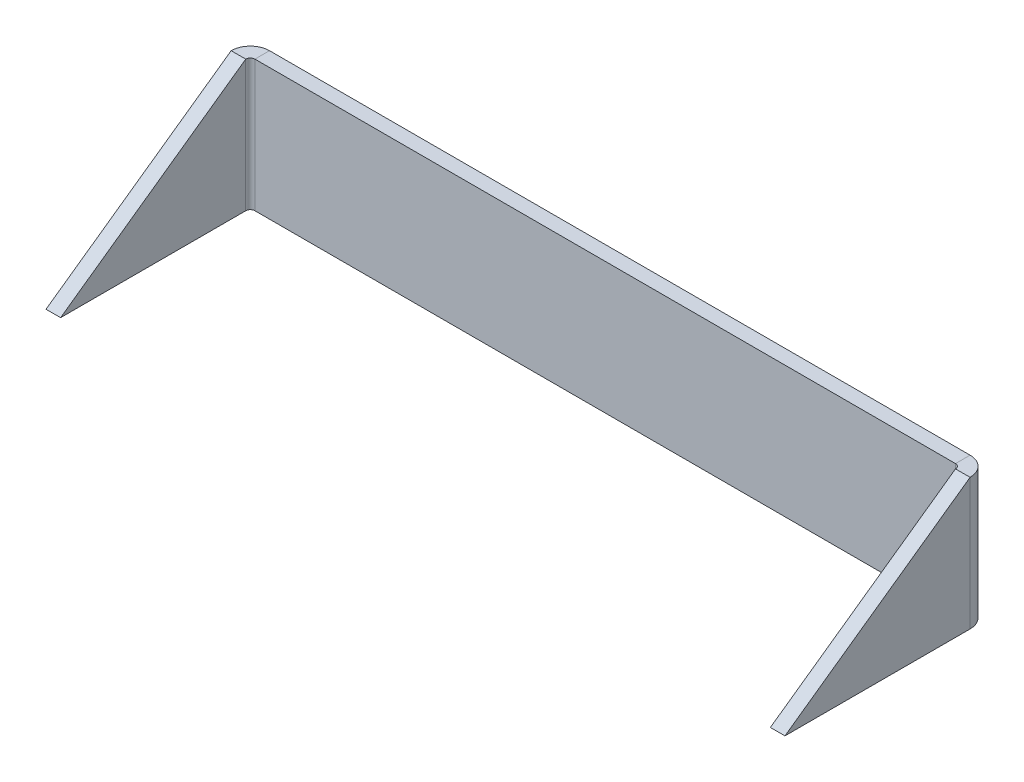
from build123d import *

# Parameters (mm, degrees)
SKETCH2_W          = 152.4
SKETCH2_H          = 28.575
BASE_FLANGE1_DEPTH = 3.175
EDGE_FLANGE1_DEPTH = 28.575
CUT_EXTRUDE1_START = -3.175
CUT_EXTRUDE1_DEPTH = 167.563083351


# Sheet-metal steps are written as plain solids
with BuildPart() as part:
    # Sketch2 → Base-Flange1 (new body)
    with BuildSketch(Plane.XY):
        Rectangle(SKETCH2_W, SKETCH2_H)
    extrude(amount=BASE_FLANGE1_DEPTH)

    # Edge-Flange1 section (across the edge) → Edge-Flange1 (add)
    with BuildSketch(Plane(origin=(77.2, -14.2875, 3.175), x_dir=(-1, 0, 0), z_dir=(0, 1, 0))):
        with BuildLine():
            Line((-3.175, 1), (-3.175, 41.275))
            Line((-3.175, 41.275), (0, 41.275))
            Line((0, 41.275), (0, 1))
            ThreePointArc((0, 1), (0.292893219, 0.292893219), (1, 0))
            Line((1, 0), (1, -3.175))
            ThreePointArc((1, -3.175), (-1.952170811, -1.952170811), (-3.175, 1))
        make_face()
    edge_flange1 = extrude(amount=EDGE_FLANGE1_DEPTH)

    # Sketch10 → Cut-Extrude1 (cut)
    with BuildSketch(Plane(origin=(80.375, 0, 0), x_dir=(0, 0, -1), z_dir=(1, 0, 0)).offset(CUT_EXTRUDE1_START)):
        Polygon((-4.175, 14.2875), (-44.45, -14.2875), (-44.45, 14.2875), align=None)
    cut_extrude1 = extrude(amount=CUT_EXTRUDE1_DEPTH, mode=Mode.SUBTRACT)

    # Mirror1: Edge-Flange1, Cut-Extrude1 across plane
    add(edge_flange1.mirror(Plane(origin=(0, 0, 0), x_dir=(0, 0, 1), z_dir=(1, 0, 0))))
    add(cut_extrude1.mirror(Plane(origin=(0, 0, 0), x_dir=(0, 0, 1), z_dir=(1, 0, 0))), mode=Mode.SUBTRACT)


solid = part.part
